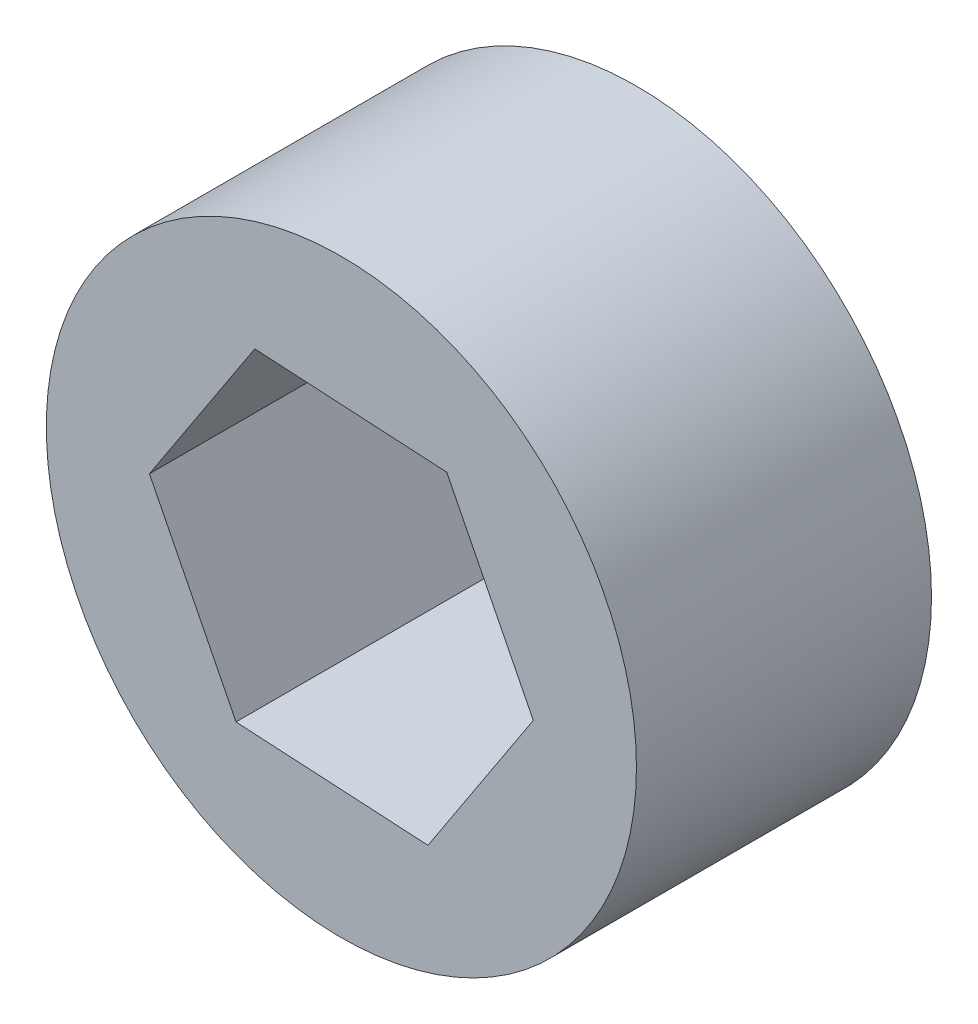
from build123d import *

# Parameters (mm, degrees)
SKETCH1_R           = 8.89
BOSS_EXTRUDE1_DEPTH = 4.445


with BuildPart() as part:
    # Sketch1 → Boss-Extrude1 (new, symmetric)
    with BuildSketch(Plane.XY):
        with Locations((0.776956632, -0.326883565)):
            Circle(SKETCH1_R)
        Polygon((-5.006367972, 0), (-2.397795141, -5.171947807), (3.385529462, -5.498831372), (6.560281235, -0.653767129), (3.951708404, 4.518180678), (-1.831616199, 4.845064243), align=None, mode=Mode.SUBTRACT)
    extrude(amount=BOSS_EXTRUDE1_DEPTH, both=True)


solid = part.part
